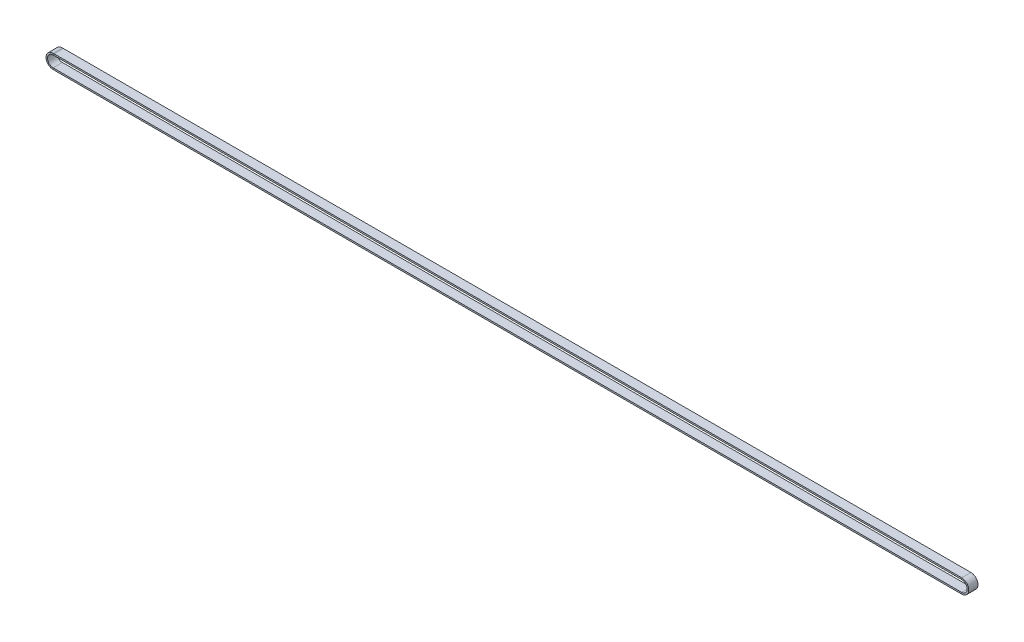
from build123d import *

# Parameters (mm, degrees)
SKETCH3_W = 9
SKETCH3_H = 1.5


with BuildPart() as part:
    # Sweep1: sweep along a path in Sketch2
    with BuildLine(Plane.XY) as sweep1_path:
        Line((-0.999999916, -54.641400136), (883.520637914, -54.641400136))
        ThreePointArc((883.520637914, -54.641400136), (890.420637914, -61.541400136), (883.520637915, -68.441400136))
        Line((883.520637915, -68.441400136), (-0.999999915, -68.441400136))
        ThreePointArc((-0.999999915, -68.441400136), (-7.899999915, -61.541400136), (-0.999999916, -54.641400136))
    # Sketch3 → Sweep1 (sweep)
    with BuildSketch(Plane(origin=(0, 0, 0), x_dir=(0, 0, -1), z_dir=(1, 0, 0))):
        with Locations((-4.5, -55.391400136)):
            Rectangle(SKETCH3_W, SKETCH3_H)
    sweep(path=sweep1_path.line)


solid = part.part
